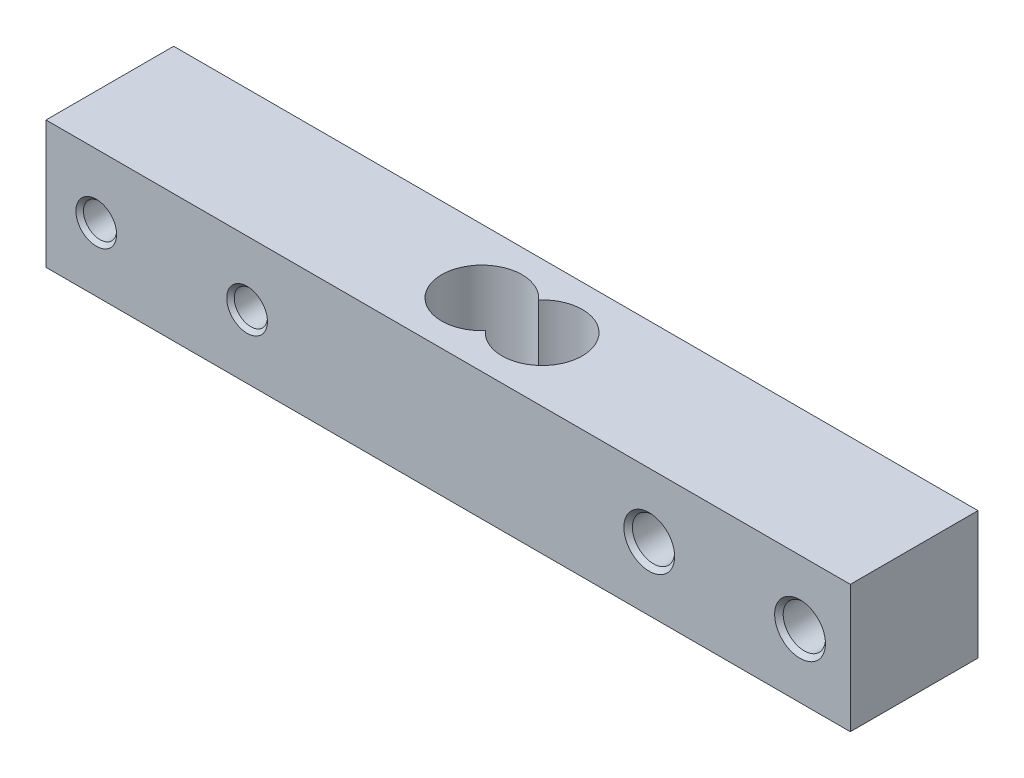
from build123d import *

# Parameters (mm, degrees)
ESQUISSE1_W                 = 80
ESQUISSE1_H                 = 12.7
BOSS_EXTRU_1_DEPTH          = 12.7
TROU_TARAUD_M41_D           = 3.3
TROU_TARAUD_M41_CSINK_D     = 4.05
TROU_TARAUD_M41_CSINK_ANGLE = 90
ENL_V_START                 = -6.35
ENL_V_MAT_EXTRU_1_DEPTH     = 12.7


# Read off the part's stored shape, not the designer's step: Trou taraudé M51
with BuildPart() as part:
    # Esquisse1 → Boss.-Extru.1 (new body)
    with BuildSketch(Plane.XY):
        Rectangle(ESQUISSE1_W, ESQUISSE1_H)
    extrude(amount=BOSS_EXTRU_1_DEPTH)

    # Trou taraudé M41 (through all)
    with Locations(Plane.XY.offset(12.7)):
        with Locations((-35, 0), (-20, 0)):
            CounterSinkHole(TROU_TARAUD_M41_D / 2, TROU_TARAUD_M41_CSINK_D / 2, counter_sink_angle=TROU_TARAUD_M41_CSINK_ANGLE)

    # Esquisse4 → Enlèv. mat.-Extru.1 (cut)
    with BuildSketch(Plane(origin=(0, 0, 0), x_dir=(1, 0, 0), z_dir=(0, 1, 0)).offset(ENL_V_START)):
        with BuildLine():
            ThreePointArc((0, -3.704248689), (-7, -6.35), (0, -8.995751311))
            ThreePointArc((0, -8.995751311), (7, -6.35), (0, -3.704248689))
        make_face()
    extrude(amount=ENL_V_MAT_EXTRU_1_DEPTH, mode=Mode.SUBTRACT)

    # Trou taraudé M51 outline → Trou taraudé M51 (revolve, cut)
    with BuildSketch(Plane(origin=(35, 0, 0), x_dir=(1, 0, 0), z_dir=(0, -1, 0))):
        Polygon((0, 0), (2.1, 0), (2.1, 12.275), (2.525, 12.7), (0, 12.7), align=None)
    revolve(axis=Axis((35, 0, 0), (0, 0, 1)), mode=Mode.SUBTRACT)

    # Trou taraud_ M51 2 outline → Trou taraud_ M51 2 (revolve, cut)
    with BuildSketch(Plane(origin=(20, 0, 0), x_dir=(1, 0, 0), z_dir=(0, -1, 0))):
        Polygon((0, 0), (2.1, 0), (2.1, 12.275), (2.525, 12.7), (0, 12.7), align=None)
    revolve(axis=Axis((20, 0, 0), (0, 0, 1)), mode=Mode.SUBTRACT)


solid = part.part
